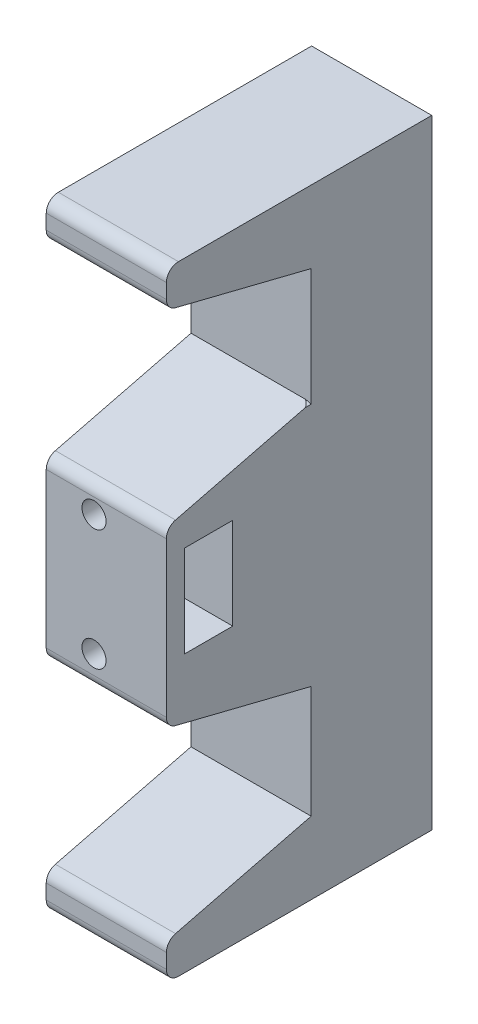
from build123d import *

# Parameters (mm, degrees)
BOSS_EXTRUDE1_START     = -4.032483
SKETCH2_W               = 12.650748945
SKETCH2_H               = 65.169112304
BOSS_EXTRUDE1_DEPTH     = 12.7
BOSS_EXTRUDE3_START     = -4.032483117
BOSS_EXTRUDE3_OUTLINE_W = 12.650748945
BOSS_EXTRUDE3_OUTLINE_H = 7.62
BOSS_EXTRUDE3_DEPTH     = 15.24
SKETCH3_R               = 1.778
CUT_EXTRUDE1_DEPTH      = 7.62
SKETCH3_3_R             = 1.27
CUT_EXTRUDE2_DEPTH      = 68.330862042
CUT_EXTRUDE6_DEPTH      = 56.374578465
FILLET1_R               = 1.27
CAVITY1_START           = -22.170556152
CAVITY1_OUTLINE_W       = 12.650748945
CAVITY1_OUTLINE_H       = 5.08
CAVITY1_DEPTH           = 9.652


# Read off the part's stored shape, not the designer's step: Boss-Extrude3, Cavity1
with BuildPart() as part:
    # Sketch2 → Boss-Extrude1 (new body)
    with BuildSketch(Plane.XY.offset(BOSS_EXTRUDE1_START)):
        with Locations((27.23762425, -18.663141358)):
            Rectangle(SKETCH2_W, SKETCH2_H)
    extrude(amount=-BOSS_EXTRUDE1_DEPTH)

    # Boss-Extrude3 outline → Boss-Extrude3 (add)
    with BuildSketch(Plane.XY.offset(BOSS_EXTRUDE3_START)):
        with Locations((27.23762425, 10.111414794)):
            Rectangle(BOSS_EXTRUDE3_OUTLINE_W, BOSS_EXTRUDE3_OUTLINE_H)
        with BuildLine():
            Line((32.8, -5.914556152), (20.912249778, -5.914556152))
            Line((20.912249778, -5.914556152), (20.912249778, -31.798585206))
            Line((20.912249778, -31.798585206), (33.562998723, -31.798585206))
            Line((33.562998723, -31.798585206), (33.562998723, -6.065817947))
            ThreePointArc((33.562998723, -6.065817947), (33.188923894, -5.952736026), (32.8, -5.914556152))
        make_face()
        with Locations((27.23762425, -47.43769751)):
            Rectangle(BOSS_EXTRUDE3_OUTLINE_W, BOSS_EXTRUDE3_OUTLINE_H)
    extrude(amount=BOSS_EXTRUDE3_DEPTH)

    # Sketch3 → Cut-Extrude1 (cut)
    with BuildSketch(Plane(origin=(0, 0, -16.732483117), x_dir=(-1, 0, 0), z_dir=(0, 0, -1))):
        with Locations((-29.752998723, -18.663141358)):
            Circle(SKETCH3_R)
    extrude(amount=-CUT_EXTRUDE1_DEPTH, mode=Mode.SUBTRACT)

    # Sketch3<3> → Cut-Extrude2 (cut, through all)
    with BuildSketch(Plane(origin=(0, 0, -16.732483117), x_dir=(-1, 0, 0), z_dir=(0, 0, -1))):
        with Locations((-25.942998723, -12.313141358)):
            Circle(SKETCH3_3_R)
        with Locations((-25.942998723, -25.013141358)):
            Circle(SKETCH3_3_R)
    extrude(amount=-CUT_EXTRUDE2_DEPTH, mode=Mode.SUBTRACT)

    # Sketch7 → Cut-Extrude6 (cut, through all)
    with BuildSketch(Plane.ZY.offset(-20.912249778)):
        Polygon((11.207516883, 6.301414794), (11.207516883, 10.111414794), (-4.032483117, 6.301414794), align=None)
        Polygon((-4.032483117, -5.914556152), (11.207516883, -5.914556152), (11.207516883, -9.724556152), align=None)
        Polygon((-4.032483117, -43.62769751), (11.207516883, -47.43769751), (11.207516883, -43.62769751), align=None)
        Polygon((11.207516883, -31.798585206), (11.207516883, -27.988585206), (-4.032483117, -31.798585206), align=None)
    extrude(amount=-CUT_EXTRUDE6_DEPTH, mode=Mode.SUBTRACT)

    # Fillet1
    fillet1_edges = [part.edges().sort_by_distance(p)[0] for p in [
        (27.237624251, -9.724556152, 11.207516883),
        (27.23762425, -51.24769751, 11.207516883),
        (27.23762425, 13.921414794, 11.207516883),
        (27.237624251, 10.111414794, 11.207516883),
        (27.237624251, -27.988585206, 11.207516883),
        (27.237624251, -47.43769751, 11.207516883),
    ]]
    fillet(fillet1_edges, radius=FILLET1_R)

    # Cavity1 outline → Cavity1 (cut)
    with BuildSketch(Plane(origin=(0, 0, 0), x_dir=(1, 0, 0), z_dir=(0, 1, 0)).offset(CAVITY1_START)):
        with Locations((27.23762425, -6.762516883)):
            Rectangle(CAVITY1_OUTLINE_W, CAVITY1_OUTLINE_H)
    extrude(amount=CAVITY1_DEPTH, mode=Mode.SUBTRACT)


solid = part.part
